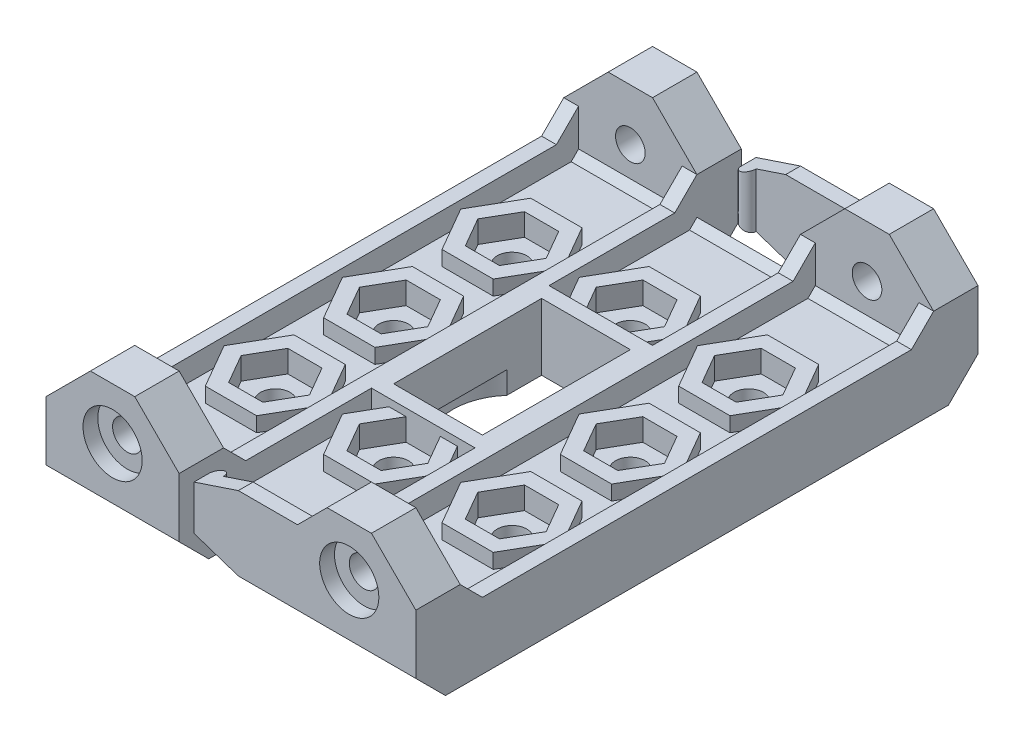
from build123d import *

# Parameters (mm, degrees)
SKETCH1_R                = 1.5
SKETCH1_R_2              = 1
SKETCH1_W                = 6
SKETCH1_H                = 10
EXTRUDE1_DEPTH           = 3
EXTRUDE2_DEPTH           = 4
EXTRUDE3_DEPTH           = 4
SKETCH7_W                = 1
SKETCH7_H                = 38
SKETCH7_W_2              = 6
SKETCH7_H_2              = 10
EXTRUDE4_DEPTH           = 4.5
EXTRUDE5_DEPTH           = 6
SKETCH9_R                = 5.5
SKETCH9_R_2              = 1.5
EXTRUDE10_DEPTH          = 3.5
EXTRUDE11_DEPTH          = 6
EXTRUDE12_DEPTH          = 4
CUT_EXTRUDE1_DEPTH       = 4
CUT_EXTRUDE2_DEPTH       = 4
SKETCH16_R               = 1
EXTRUDE13_DEPTH          = 3
CUT_EXTRUDE4_DEPTH       = 3
CUT_EXTRUDE5_DEPTH       = 32.906112267
CUT_EXTRUDE6_DEPTH       = 2
EXTRUDE14_DEPTH          = 25
EXTRUDE15_DEPTH          = 1
EXTRUDE17_DEPTH          = 1
EXTRUDE18_DEPTH          = 1
EXTRUDE19_DEPTH          = 1
CUT_EXTRUDE7_DEPTH       = 43.121847063
SKETCH26_R               = 2
CUT_EXTRUDE8_DEPTH       = 1
SKETCH27_R               = 4
CUT_EXTRUDE9_DEPTH       = 1.5
SKETCH28_R               = 4
CUT_EXTRUDE10_DEPTH      = 1
CUT_EXTRUDE11_DEPTH      = 1.5
FILLET4_R                = 0.25
CUT_EXTRUDE12_DEPTH      = 1.5
SKETCH31_W               = 16.002833782
SKETCH31_H               = 38
CUT_EXTRUDE13_DEPTH      = 32.906112267
CUT_EXTRUDE14_DEPTH      = 14.5
CUT_EXTRUDE14_DEPTH_BACK = 14.5
EXTRUDE20_DEPTH          = 15
EXTRUDE20_DEPTH_BACK     = 15
EXTRUDE21_DEPTH          = 1
CUT_EXTRUDE15_DEPTH      = 0.5
SKETCH36_R               = 1
CUT_EXTRUDE16_DEPTH      = 10.5


with BuildPart() as part:
    # Sketch1 → Extrude1 (new body)
    with BuildSketch(Plane(origin=(0, 0, 0), x_dir=(1, 0, 0), z_dir=(0, 1, 0))):
        with BuildLine():
            Line((-12.5, -19), (-12.5, -12.75))
            ThreePointArc((-12.5, -12.75), (-13.085786438, -11.335786438), (-14.5, -10.75))
            Line((-14.5, -10.75), (-19, -10.75))
            ThreePointArc((-19, -10.75), (-22.535533906, -9.285533906), (-24, -5.75))
            Line((-24, -5.75), (-24, 5.75))
            ThreePointArc((-24, 5.75), (-22.535533906, 9.285533906), (-19, 10.75))
            Line((-19, 10.75), (-14.5, 10.75))
            ThreePointArc((-14.5, 10.75), (-13.085786438, 11.335786438), (-12.5, 12.75))
            Line((-12.5, 12.75), (-12.5, 19))
            Line((-12.5, 19), (12.5, 19))
            Line((12.5, 19), (12.5, -19))
            Line((12.5, -19), (-12.5, -19))
        make_face()
        with Locations((-14.5, 0)):
            Circle(SKETCH1_R, mode=Mode.SUBTRACT)
        with Locations((0, 8)):
            Circle(SKETCH1_R_2, mode=Mode.SUBTRACT)
        with Locations((8, 0)):
            Circle(SKETCH1_R_2, mode=Mode.SUBTRACT)
        with Locations((0, -8)):
            Circle(SKETCH1_R_2, mode=Mode.SUBTRACT)
        with Locations((-8, 0)):
            Circle(SKETCH1_R_2, mode=Mode.SUBTRACT)
        with Locations((-20.156854249, 5.656854249)):
            Circle(SKETCH1_R_2, mode=Mode.SUBTRACT)
        with Locations((-20.156854249, -5.656854249)):
            Circle(SKETCH1_R_2, mode=Mode.SUBTRACT)
        with Locations((-8.843145751, -5.656854249)):
            Circle(SKETCH1_R_2, mode=Mode.SUBTRACT)
        with Locations((-8.843145751, 5.656854249)):
            Circle(SKETCH1_R_2, mode=Mode.SUBTRACT)
        with Locations((8, 8)):
            Circle(SKETCH1_R_2, mode=Mode.SUBTRACT)
        with Locations((8, -8)):
            Circle(SKETCH1_R_2, mode=Mode.SUBTRACT)
        Rectangle(SKETCH1_W, SKETCH1_H, mode=Mode.SUBTRACT)
    extrude(amount=EXTRUDE1_DEPTH)

    # Sketch2 → Extrude2 (add)
    # profile 1 of 4: a face of its own
    with BuildSketch(Plane(origin=(0, 0, 0), x_dir=(1, 0, 0), z_dir=(0, 1, 0))):
        Polygon((-19.260278777, -2.310789035), (-16.810789035, -4.760278777), (-17.707364507, -8.106343992), (-21.053429722, -9.002919464), (-23.502919464, -6.553429722), (-22.606343992, -3.207364507), align=None)
        Polygon((-19.559663372, -3.426127712), (-17.926258803, -5.058709362), (-18.523413702, -7.289570039), (-20.75397317, -7.887849066), (-22.387377739, -6.255267415), (-21.79022284, -4.024406738), align=None, mode=Mode.SUBTRACT)
    # profile 2 of 4: a face of its own
    with BuildSketch(Plane(origin=(0, 0, 0), x_dir=(1, 0, 0), z_dir=(0, 1, 0))):
        Polygon((-6.393656008, 3.207364507), (-9.739721223, 2.310789035), (-12.189210965, 4.760278777), (-11.292635493, 8.106343992), (-7.946570278, 9.002919464), (-5.497080536, 6.553429722), align=None)
        Polygon((-7.210429961, 4.023413702), (-9.441290638, 3.426258803), (-11.073872288, 5.059663372), (-10.475593262, 7.29022284), (-8.244732585, 7.887377739), (-6.612150934, 6.25397317), align=None, mode=Mode.SUBTRACT)
    # profile 3 of 4: a face of its own
    with BuildSketch(Plane(origin=(0, 0, 0), x_dir=(1, 0, 0), z_dir=(0, 1, 0))):
        Polygon((-16.810789035, 4.760278777), (-19.260278777, 2.310789035), (-22.606343992, 3.207364507), (-23.502919464, 6.553429722), (-21.053429722, 9.002919464), (-17.707364507, 8.106343992), align=None)
        Polygon((-17.926127712, 5.059663372), (-19.558709362, 3.426258803), (-21.789570039, 4.023413702), (-22.387849066, 6.25397317), (-20.755267415, 7.887377739), (-18.524406738, 7.29022284), align=None, mode=Mode.SUBTRACT)
    # profile 4 of 4: a face of its own
    with BuildSketch(Plane(origin=(0, 0, 0), x_dir=(1, 0, 0), z_dir=(0, 1, 0))):
        Polygon((-12.189210965, -4.760278777), (-9.739721223, -2.310789035), (-6.393656008, -3.207364507), (-5.497080536, -6.553429722), (-7.946570278, -9.002919464), (-11.292635493, -8.106343992), align=None)
        Polygon((-11.073872288, -5.059663372), (-9.441290638, -3.426258803), (-7.210429961, -4.023413702), (-6.612150934, -6.25397317), (-8.244732585, -7.887377739), (-10.475593262, -7.29022284), align=None, mode=Mode.SUBTRACT)
    extrude(amount=EXTRUDE2_DEPTH)

    # Sketch5 → Extrude3 (add)
    # profile 1 of 6: a face of its own
    with BuildSketch(Plane(origin=(0, 0, 0), x_dir=(1, 0, 0), z_dir=(0, 1, 0))):
        Polygon((-3.464101615, -8), (-1.732050808, -11), (1.732050808, -11), (3.464101615, -8), (1.732050808, -5), (-1.732050808, -5), align=None)
        Polygon((-2.309401077, -8), (-1.154700538, -10), (1.154700538, -10), (2.309401077, -8), (1.154700538, -6), (-1.154700538, -6), align=None, mode=Mode.SUBTRACT)
    # profile 2 of 6: a face of its own
    with BuildSketch(Plane(origin=(0, 0, 0), x_dir=(1, 0, 0), z_dir=(0, 1, 0))):
        Polygon((-1.732050808, 11), (1.732050808, 11), (3.464101615, 8), (1.732050808, 5), (-1.732050808, 5), (-3.464101615, 8), align=None)
        Polygon((-1.154700538, 10), (1.154700538, 10), (2.309401077, 8), (1.154700538, 6), (-1.154700538, 6), (-2.309401077, 8), align=None, mode=Mode.SUBTRACT)
    # profile 3 of 6: a face of its own
    with BuildSketch(Plane(origin=(0, 0, 0), x_dir=(1, 0, 0), z_dir=(0, 1, 0))):
        Polygon((11.464101615, 8), (9.732050808, 11), (6.267949192, 11), (4.535898385, 8), (6.267949192, 5), (9.732050808, 5), align=None)
        Polygon((10.309401077, 8), (9.154700538, 10), (6.845299462, 10), (5.690598923, 8), (6.845299462, 6), (9.154700538, 6), align=None, mode=Mode.SUBTRACT)
    # profile 4 of 6: a face of its own
    with BuildSketch(Plane(origin=(0, 0, 0), x_dir=(1, 0, 0), z_dir=(0, 1, 0))):
        Polygon((9.732050808, -11), (6.267949192, -11), (4.535898385, -8), (6.267949192, -5), (9.732050808, -5), (11.464101615, -8), align=None)
        Polygon((9.154700538, -10), (6.845299462, -10), (5.690598923, -8), (6.845299462, -6), (9.154700538, -6), (10.309401077, -8), align=None, mode=Mode.SUBTRACT)
    # profile 5 of 6: a face of its own
    with BuildSketch(Plane(origin=(0, 0, 0), x_dir=(1, 0, 0), z_dir=(0, 1, 0))):
        Polygon((9.732050808, -3), (6.267949192, -3), (4.535898385, 0), (6.267949192, 3), (9.732050808, 3), (11.464101615, 0), align=None)
        Polygon((9.154700538, -2), (6.845299462, -2), (5.690598923, 0), (6.845299462, 2), (9.154700538, 2), (10.309401077, 0), align=None, mode=Mode.SUBTRACT)
    # profile 6 of 6: a face of its own
    with BuildSketch(Plane(origin=(0, 0, 0), x_dir=(1, 0, 0), z_dir=(0, 1, 0))):
        Polygon((-11, -1.732050808), (-11, 1.732050808), (-8, 3.464101615), (-5, 1.732050808), (-5, -1.732050808), (-8, -3.464101615), align=None)
        Polygon((-10, -1.154700538), (-10, 1.154700538), (-8, 2.309401077), (-6, 1.154700538), (-6, -1.154700538), (-8, -2.309401077), align=None, mode=Mode.SUBTRACT)
    extrude(amount=EXTRUDE3_DEPTH)

    # Sketch7 → Extrude4 (add)
    # profile 1 of 3: a face of its own
    with BuildSketch(Plane(origin=(0, 0, 0), x_dir=(1, 0, 0), z_dir=(0, 1, 0))):
        with Locations((-12, 0)):
            Rectangle(SKETCH7_W, SKETCH7_H)
    # profile 2 of 3: a face of its own
    with BuildSketch(Plane(origin=(0, 0, 0), x_dir=(1, 0, 0), z_dir=(0, 1, 0))):
        Polygon((-4.5, 19), (-3.5, 19), (-3.5, 6), (3.5, 6), (3.5, 19), (4.5, 19), (4.5, -19), (3.5, -19), (3.5, -6), (-3.5, -6), (-3.5, -19), (-4.5, -19), align=None)
        Rectangle(SKETCH7_W_2, SKETCH7_H_2, mode=Mode.SUBTRACT)
    # profile 3 of 3: a face of its own
    with BuildSketch(Plane(origin=(0, 0, 0), x_dir=(1, 0, 0), z_dir=(0, 1, 0))):
        with Locations((12, 0)):
            Rectangle(SKETCH7_W, SKETCH7_H)
    extrude(amount=EXTRUDE4_DEPTH)

    # Sketch8 → Extrude5 (add)
    with BuildSketch(Plane(origin=(0, 0, 0), x_dir=(1, 0, 0), z_dir=(0, 1, 0))):
        with BuildLine():
            Line((-11.5, -9.748913396), (-11.5, -10.25))
            ThreePointArc((-11.5, -10.25), (-11.646446609, -10.603553391), (-12, -10.75))
            Line((-12, -10.75), (-19, -10.75))
            ThreePointArc((-19, -10.75), (-22.535533906, -9.285533906), (-24, -5.75))
            Line((-24, -5.75), (-24, 5.751086604))
            ThreePointArc((-24, 5.751086604), (-22.535533906, 9.28662051), (-19, 10.751086604))
            Line((-19, 10.751086604), (-12, 10.751086604))
            ThreePointArc((-12, 10.751086604), (-11.646446609, 10.604639995), (-11.5, 10.251086604))
            Line((-11.5, 10.251086604), (-11.5, 9.751086604))
            ThreePointArc((-11.5, 9.751086604), (-11.646446609, 9.397533214), (-12, 9.251086604))
            Line((-12, 9.251086604), (-19, 9.251086604))
            ThreePointArc((-19, 9.251086604), (-21.474873734, 8.225960339), (-22.5, 5.751086604))
            Line((-22.5, 5.751086604), (-22.5, -5.748913396))
            ThreePointArc((-22.5, -5.748913396), (-21.474873734, -8.22378713), (-19, -9.248913396))
            Line((-19, -9.248913396), (-12, -9.248913396))
            ThreePointArc((-12, -9.248913396), (-11.646446609, -9.395360005), (-11.5, -9.748913396))
        make_face()
    extrude(amount=EXTRUDE5_DEPTH)

    # Sketch9 → Extrude10 (add)
    with BuildSketch(Plane(origin=(0, 0, 0), x_dir=(1, 0, 0), z_dir=(0, 1, 0))):
        with Locations((-14.5, 0)):
            Circle(SKETCH9_R)
        with Locations((-14.5, 0)):
            Circle(SKETCH9_R_2, mode=Mode.SUBTRACT)
    extrude(amount=EXTRUDE10_DEPTH)

    # Sketch10 → Extrude11 (add)
    with BuildSketch(Plane(origin=(0, 0, 0), x_dir=(1, 0, 0), z_dir=(0, 1, 0))):
        Polygon((-16.953738644, 4.25), (-12.046261356, 4.25), (-9.592522712, 0), (-12.046261356, -4.25), (-16.953738644, -4.25), (-19.407477288, 0), align=None)
        Polygon((-16.232050808, 3), (-12.767949192, 3), (-11.035898385, 0), (-12.767949192, -3), (-16.232050808, -3), (-17.964101615, 0), align=None, mode=Mode.SUBTRACT)
    extrude(amount=EXTRUDE11_DEPTH)

    # Sketch12 → Extrude12 (add)
    with BuildSketch(Plane(origin=(0, 0, 0), x_dir=(1, 0, 0), z_dir=(0, 1, 0))):
        with BuildLine():
            Line((-11.5, 4.609772229), (-11.5, -4.609772229))
            ThreePointArc((-11.5, -4.609772229), (-9, 0), (-11.5, 4.609772229))
        make_face()
    extrude(amount=EXTRUDE12_DEPTH)

    # Sketch13 → Cut-Extrude1 (cut)
    with BuildSketch(Plane(origin=(0, 3.5, 0), x_dir=(-1, 0, 0), z_dir=(0, 1, 0))):
        Polygon((11.035898385, 0), (12.767949192, 3), (16.232050808, 3), (17.964101615, 0), (16.232050808, -3), (12.767949192, -3), align=None)
    extrude(amount=CUT_EXTRUDE1_DEPTH, mode=Mode.SUBTRACT)

    # Sketch14 → Cut-Extrude2 (cut)
    with BuildSketch(Plane(origin=(0, 3, 0), x_dir=(-1, 0, 0), z_dir=(0, 1, 0))):
        Polygon((8, -2.309401077), (10, -1.154700538), (10, 1.154700538), (8, 2.309401077), align=None)
    extrude(amount=CUT_EXTRUDE2_DEPTH, mode=Mode.SUBTRACT)

    # Sketch16 → Extrude13 (add)
    # profile 1 of 2: a face of its own
    with BuildSketch(Plane.XY.offset(19)):
        Polygon((12.5, 0), (12.5, 6), (9.5, 9), (6.5, 9), (4.5, 7), (0.5, 7), (-2.5, 6), (-2.5, 3), (0.5, 2), (3.5, 2), (3.5, 0), align=None)
        with Locations((8, 5.5)):
            Circle(SKETCH16_R, mode=Mode.SUBTRACT)
    # profile 2 of 2: a face of its own
    with BuildSketch(Plane.XY.offset(19)):
        Polygon((-6.5, 9), (-3.5, 6), (-3.5, 0), (-12.5, 0), (-12.5, 6), (-9.5, 9), align=None)
        with Locations((-8, 5.5)):
            Circle(SKETCH16_R, mode=Mode.SUBTRACT)
    extrude13 = extrude(amount=-EXTRUDE13_DEPTH)

    # Sketch17 → Cut-Extrude4 (cut)
    with BuildSketch(Plane.XY.offset(19)):
        Polygon((-2.5, 3), (0.5, 2), (4.5, 2), (4.5, 0), (-3.5, 0), (-3.5, 3), align=None)
    cut_extrude4 = extrude(amount=-CUT_EXTRUDE4_DEPTH, mode=Mode.SUBTRACT)

    # Sketch18 → Cut-Extrude5 (cut, through all)
    with BuildSketch(Plane(origin=(0, 0, 0), x_dir=(1, 0, 0), z_dir=(0, 1, 0))):
        with BuildLine():
            Line((-2.5, -16), (3.5, -16))
            Line((3.5, -16), (3.5, -18))
            Line((3.5, -18), (-1.5, -18))
            ThreePointArc((-1.5, -18), (-2, -17.5), (-2.5, -18))
            Line((-2.5, -18), (-2.5, -16))
        make_face()
    cut_extrude5 = extrude(amount=CUT_EXTRUDE5_DEPTH, mode=Mode.SUBTRACT)

    # Sketch19 → Cut-Extrude6 (cut)
    with BuildSketch(Plane(origin=(0, 0, 16), x_dir=(-1, 0, 0), z_dir=(0, 0, -1))):
        Polygon((-4.5, 7), (-3.5, 6), (-3.5, 7), align=None)
    cut_extrude6 = extrude(amount=-CUT_EXTRUDE6_DEPTH, mode=Mode.SUBTRACT)

    # Sketch20 → Extrude14 (add)
    with BuildSketch(Plane(origin=(12.5, 0, 0), x_dir=(0, 0, -1), z_dir=(1, 0, 0))):
        Polygon((-16, 3), (-15.5, 3), (-16, 3.5), align=None)
    extrude14 = extrude(amount=-EXTRUDE14_DEPTH)

    # Sketch21 → Extrude15 (add)
    with BuildSketch(Plane(origin=(12.5, 0, 0), x_dir=(0, 0, -1), z_dir=(1, 0, 0))):
        Polygon((-16, 6), (-14.5, 4.5), (-16, 4.5), align=None)
    extrude15 = extrude(amount=-EXTRUDE15_DEPTH)

    # Sketch22 → Extrude17 (add)
    with BuildSketch(Plane(origin=(4.5, 0, 0), x_dir=(0, 0, -1), z_dir=(1, 0, 0))):
        Polygon((-16, 6), (-14.5, 4.5), (-16, 4.5), align=None)
    extrude17 = extrude(amount=-EXTRUDE17_DEPTH)

    # Sketch23 → Extrude18 (add)
    with BuildSketch(Plane(origin=(-3.5, 0, 0), x_dir=(0, 0, -1), z_dir=(1, 0, 0))):
        Polygon((-16, 6), (-14.5, 4.5), (-16, 4.5), align=None)
    extrude18 = extrude(amount=-EXTRUDE18_DEPTH)

    # Sketch24 → Extrude19 (add)
    with BuildSketch(Plane(origin=(-11.5, 0, 0), x_dir=(0, 0, -1), z_dir=(1, 0, 0))):
        Polygon((-16, 6), (-14.5, 4.5), (-16, 4.5), align=None)
    extrude19 = extrude(amount=-EXTRUDE19_DEPTH)

    # Sketch25 → Cut-Extrude7 (cut, through all)
    with BuildSketch(Plane(origin=(12.5, 0, 0), x_dir=(0, 0, -1), z_dir=(1, 0, 0))):
        Polygon((-19, 0), (-17, 0), (-19, 2), align=None)
    cut_extrude7 = extrude(amount=-CUT_EXTRUDE7_DEPTH, mode=Mode.SUBTRACT)

    # Sketch26 → Cut-Extrude8 (cut)
    with BuildSketch(Plane.XY.offset(19)):
        with Locations((-8, 5.5)):
            Circle(SKETCH26_R)
        with Locations((8, 5.5)):
            Circle(SKETCH26_R)
    cut_extrude8 = extrude(amount=-CUT_EXTRUDE8_DEPTH, mode=Mode.SUBTRACT)

    # Mirror1: Extrude13, Cut-Extrude4, Cut-Extrude5, Cut-Extrude6, Extrude14, Extrude15, Extrude17, Extrude18, Extrude19, Cut-Extrude7, Cut-Extrude8 across plane
    add(extrude13.mirror(Plane.XY))
    add(cut_extrude4.mirror(Plane.XY), mode=Mode.SUBTRACT)
    add(cut_extrude5.mirror(Plane.XY), mode=Mode.SUBTRACT)
    add(cut_extrude6.mirror(Plane.XY), mode=Mode.SUBTRACT)
    add(extrude14.mirror(Plane.XY))
    add(extrude15.mirror(Plane.XY))
    add(extrude17.mirror(Plane.XY))
    add(extrude18.mirror(Plane.XY))
    add(extrude19.mirror(Plane.XY))
    add(cut_extrude7.mirror(Plane.XY), mode=Mode.SUBTRACT)
    add(cut_extrude8.mirror(Plane.XY), mode=Mode.SUBTRACT)

    # Sketch27 → Cut-Extrude9 (cut)
    with BuildSketch(Plane.XZ):
        Circle(SKETCH27_R)
    extrude(amount=-CUT_EXTRUDE9_DEPTH, mode=Mode.SUBTRACT)

    # Sketch28 → Cut-Extrude10 (cut)
    with BuildSketch(Plane.XZ):
        with Locations((-14.5, 0)):
            Circle(SKETCH28_R)
    extrude(amount=-CUT_EXTRUDE10_DEPTH, mode=Mode.SUBTRACT)

    # Sketch29 → Cut-Extrude11 (cut)
    with BuildSketch(Plane.ZY.offset(24)):
        with BuildLine():
            Line((-2.500543302, 6), (2.499456698, 6))
            ThreePointArc((2.499456698, 6), (1.91367026, 4.585786438), (0.499456698, 4))
            Line((0.499456698, 4), (-0.500543302, 4))
            ThreePointArc((-0.500543302, 4), (-1.914756865, 4.585786438), (-2.500543302, 6))
        make_face()
    extrude(amount=-CUT_EXTRUDE11_DEPTH, mode=Mode.SUBTRACT)

    # Fillet4
    fillet4_edges = [part.edges().sort_by_distance(p)[0] for p in [
        (-11.023130678, 6, 2.477885683),
        (-14.5, 6, 4.25),
        (-18.180607966, 6, 2.125),
        (-18.180607966, 6, -2.125),
        (-14.5, 6, -4.25),
        (-11.023130678, 6, -2.477885683),
        (-10, 6, 0),
        (-17.098076211, 6, 1.5),
        (-14.5, 6, 3),
        (-11.901923789, 6, 1.5),
        (-11.901923789, 6, -1.5),
        (-14.5, 6, -3),
        (-17.098076211, 6, -1.5),
    ]]
    fillet(fillet4_edges, radius=FILLET4_R)

    # Sketch30 → Cut-Extrude12 (cut)
    with BuildSketch(Plane(origin=(0, 3.5, 0), x_dir=(-1, 0, 0), z_dir=(0, 1, 0))):
        Polygon((16.232050808, -3), (12.767949192, -3), (11.035898385, 0), (12.767949192, 3), (16.232050808, 3), (17.964101615, 0), align=None)
    extrude(amount=-CUT_EXTRUDE12_DEPTH, mode=Mode.SUBTRACT)

    # Sketch31 → Cut-Extrude13 (cut, through all)
    with BuildSketch(Plane.XZ):
        with Locations((-20.501416891, 0)):
            Rectangle(SKETCH31_W, SKETCH31_H)
    extrude(amount=-CUT_EXTRUDE13_DEPTH, mode=Mode.SUBTRACT)

    # Sketch32 → Cut-Extrude14 (cut, two sides: drawn at the far end of the back side and taken through both)
    with BuildSketch(Plane(origin=(0, 0, 0), x_dir=(-1, 0, 0), z_dir=(0, 0, -1)).offset(-CUT_EXTRUDE14_DEPTH_BACK)):
        Polygon((12.837931972, 9.642365277), (4.5, 4.5), (4.5, 3), (11.5, 3), (11.5, 4.5), (12.837931972, 4.5), align=None)
    extrude(amount=CUT_EXTRUDE14_DEPTH + CUT_EXTRUDE14_DEPTH_BACK, mode=Mode.SUBTRACT)

    # Sketch33 → Extrude20 (add, two sides: drawn at the far end of the back side and taken through both)
    with BuildSketch(Plane.XY.offset(-EXTRUDE20_DEPTH_BACK)):
        Polygon((-4.5, 0), (-12.5, 0), (-12.5, 4.5), (-11.5, 4.5), (-11.5, 3), (-4.5, 3), align=None)
    extrude(amount=EXTRUDE20_DEPTH + EXTRUDE20_DEPTH_BACK)

    # Sketch34 → Extrude21 (add)
    # profile 1 of 3: a face of its own
    with BuildSketch(Plane(origin=(0, 3, 0), x_dir=(-1, 0, 0), z_dir=(0, 1, 0))):
        Polygon((6.267949192, 5), (4.535898385, 8), (6.267949192, 11), (9.732050808, 11), (11.464101615, 8), (9.732050808, 5), align=None)
        Polygon((6.845299462, 6), (5.690598923, 8), (6.845299462, 10), (9.154700538, 10), (10.309401077, 8), (9.154700538, 6), align=None, mode=Mode.SUBTRACT)
    # profile 2 of 3: a face of its own
    with BuildSketch(Plane(origin=(0, 3, 0), x_dir=(-1, 0, 0), z_dir=(0, 1, 0))):
        Polygon((6.267949192, -3), (4.535898385, 0), (6.267949192, 3), (9.732050808, 3), (11.464101615, 0), (9.732050808, -3), align=None)
        Polygon((6.845299462, -2), (5.690598923, 0), (6.845299462, 2), (9.154700538, 2), (10.309401077, 0), (9.154700538, -2), align=None, mode=Mode.SUBTRACT)
    # profile 3 of 3: a face of its own
    with BuildSketch(Plane(origin=(0, 3, 0), x_dir=(-1, 0, 0), z_dir=(0, 1, 0))):
        Polygon((6.267949192, -11), (4.535898385, -8), (6.267949192, -5), (9.732050808, -5), (11.464101615, -8), (9.732050808, -11), align=None)
        Polygon((6.845299462, -10), (5.690598923, -8), (6.845299462, -6), (9.154700538, -6), (10.309401077, -8), (9.154700538, -10), align=None, mode=Mode.SUBTRACT)
    extrude(amount=EXTRUDE21_DEPTH)

    # Sketch35 → Cut-Extrude15 (cut)
    with BuildSketch(Plane(origin=(0, 3, 0), x_dir=(-1, 0, 0), z_dir=(0, 1, 0))):
        Polygon((10.309401077, -8), (9.154700538, -6), (6.845299462, -6), (5.690598923, -8), (6.845299462, -10), (9.154700538, -10), align=None)
        Polygon((10.309401077, 0), (9.154700538, 2), (6.845299462, 2), (5.690598923, 0), (6.845299462, -2), (9.154700538, -2), align=None)
        Polygon((-2.309401077, -8), (-1.154700538, -6), (1.154700538, -6), (2.309401077, -8), (1.154700538, -10), (-1.154700538, -10), align=None)
        Polygon((10.309401077, 8), (9.154700538, 10), (6.845299462, 10), (5.690598923, 8), (6.845299462, 6), (9.154700538, 6), align=None)
        Polygon((-1.154700538, 6), (1.154700538, 6), (2.309401077, 8), (1.154700538, 10), (-1.154700538, 10), (-2.309401077, 8), align=None)
        Polygon((-5.690598923, 0), (-6.845299462, -2), (-9.154700538, -2), (-10.309401077, 0), (-9.154700538, 2), (-6.845299462, 2), align=None)
        Polygon((-9.154700538, 6), (-10.309401077, 8), (-9.154700538, 10), (-6.845299462, 10), (-5.690598923, 8), (-6.845299462, 6), align=None)
        Polygon((-9.154700538, -10), (-10.309401077, -8), (-9.154700538, -6), (-6.845299462, -6), (-5.690598923, -8), (-6.845299462, -10), align=None)
    extrude(amount=-CUT_EXTRUDE15_DEPTH, mode=Mode.SUBTRACT)

    # Sketch36 → Cut-Extrude16 (cut)
    with BuildSketch(Plane.XZ):
        with Locations((-8, 8)):
            Circle(SKETCH36_R)
        with Locations((-8, 0)):
            Circle(SKETCH36_R)
        with Locations((-8, -8)):
            Circle(SKETCH36_R)
    extrude(amount=-CUT_EXTRUDE16_DEPTH, mode=Mode.SUBTRACT)


solid = part.part
